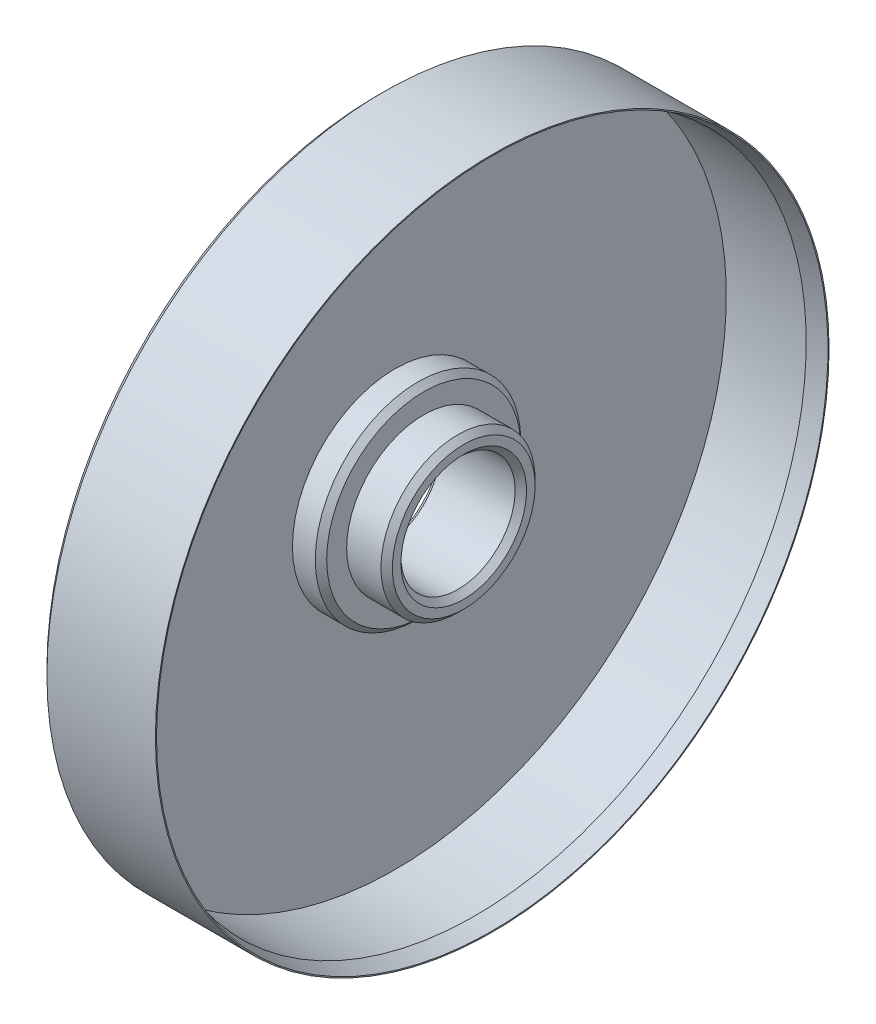
from build123d import *


with BuildPart() as part:
    # Эскиз1 → Повернуть1 (revolve)
    with BuildSketch(Plane.XY):
        Polygon((0, 11), (0, 58), (1, 59), (20, 59), (20, 58.803847577), (17, 58), (3, 58), (3, 18), (7, 18), (8, 17), (8, 13.5), (14, 13.5), (15, 12.5), (15, 11), (14, 10), (1, 10), align=None)
    revolve(axis=Axis((0, 0, 0), (1, 0, 0)))


solid = part.part
